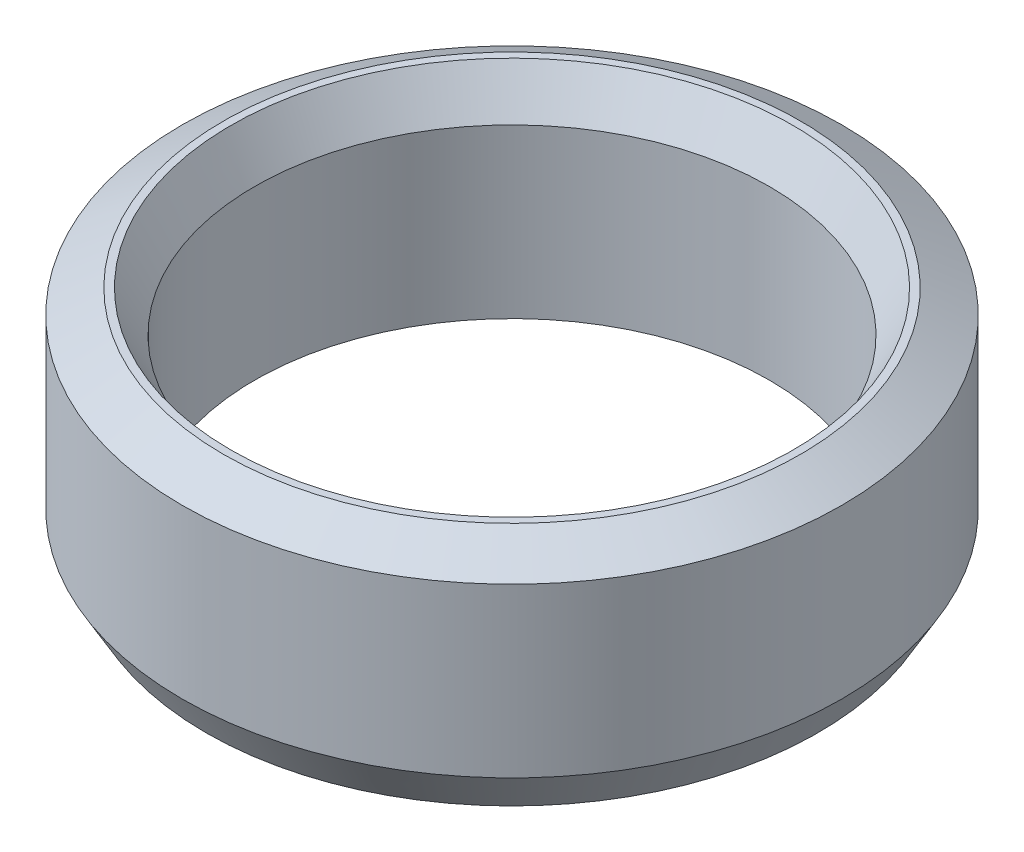
from build123d import *
from OCP.BRepFilletAPI import BRepFilletAPI_MakeChamfer

# Parameters (mm, degrees)
SKETCH1_R           = 40
BOSS_EXTRUDE1_DEPTH = 28.207598692
SKETCH2_R           = 31.231315727
CUT_EXTRUDE1_DEPTH  = 64.211301394
CHAMFER1_SIZE       = 2.876487857
CHAMFER1_SIZE2      = 4.982223115


with BuildPart() as part:
    # Sketch1 → Boss-Extrude1 (new body)
    with BuildSketch(Plane(origin=(0, 0, 0), x_dir=(1, 0, 0), z_dir=(0, 1, 0))):
        Circle(SKETCH1_R)
    extrude(amount=BOSS_EXTRUDE1_DEPTH)

    # Sketch2 → Cut-Extrude1 (cut, through all)
    with BuildSketch(Plane(origin=(0, 0, 0), x_dir=(1, 0, 0), z_dir=(0, 1, 0))):
        Circle(SKETCH2_R)
    extrude(amount=CUT_EXTRUDE1_DEPTH, mode=Mode.SUBTRACT)

    # Chamfer1: one chamfer whose edges measure the first distance from different faces: ONE call of the kernel's chamfer builder (chamfer() names one face for all edges)
    chamfer1_edges_1 = [part.edges().sort_by_distance(p)[0] for p in [
        (-31.231315727, 28.207598692, 0),
    ]]
    chamfer1_side_1 = [part.faces().sort_by_distance(p)[0] for p in [
        (-38.86862915, 28.207598692, 0),
    ]]
    chamfer1_edges_2 = [part.edges().sort_by_distance(p)[0] for p in [
        (-31.231315727, 0, 0),
    ]]
    chamfer1_side_2 = [part.faces().sort_by_distance(p)[0] for p in [
        (-31.231315727, 14.103799346, 0),
    ]]
    chamfer1_edges_3 = [part.edges().sort_by_distance(p)[0] for p in [
        (-40, 0, 0),
    ]]
    chamfer1_side_3 = [part.faces().sort_by_distance(p)[0] for p in [
        (-38.86862915, 0, 0),
    ]]
    chamfer1_edges_4 = [part.edges().sort_by_distance(p)[0] for p in [
        (-40, 28.207598692, 0),
    ]]
    chamfer1_side_4 = [part.faces().sort_by_distance(p)[0] for p in [
        (-40, 14.103799346, 0),
    ]]
    chamfer1 = BRepFilletAPI_MakeChamfer(part.part.solid().wrapped)
    for e in chamfer1_edges_1:
        chamfer1.Add(CHAMFER1_SIZE, CHAMFER1_SIZE2, e.wrapped, chamfer1_side_1[0].wrapped)  # the first distance lies on this face
    for e in chamfer1_edges_2:
        chamfer1.Add(CHAMFER1_SIZE, CHAMFER1_SIZE2, e.wrapped, chamfer1_side_2[0].wrapped)  # the first distance lies on this face
    for e in chamfer1_edges_3:
        chamfer1.Add(CHAMFER1_SIZE, CHAMFER1_SIZE2, e.wrapped, chamfer1_side_3[0].wrapped)  # the first distance lies on this face
    for e in chamfer1_edges_4:
        chamfer1.Add(CHAMFER1_SIZE, CHAMFER1_SIZE2, e.wrapped, chamfer1_side_4[0].wrapped)  # the first distance lies on this face
    add(Compound.cast(chamfer1.Shape()), mode=Mode.REPLACE)


solid = part.part
